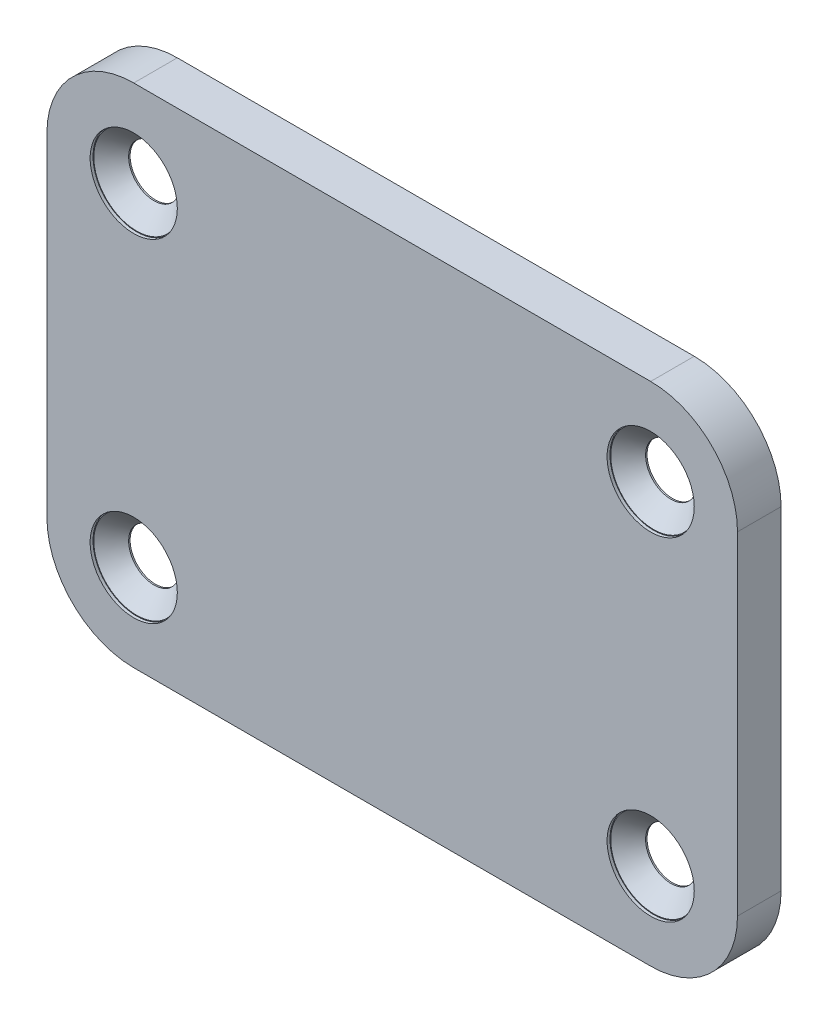
from build123d import *

# Parameters (mm, degrees)
SKETCH1_R           = 1.75
BOSS_EXTRUDE1_DEPTH = 1.5
BOSS_EXTRUDE2_START = 1.5
BOSS_EXTRUDE2_DEPTH = 1.5
CUT_EXTRUDE1_DEPTH  = 0.5
SKETCH4_R           = 3
CUT_EXTRUDE2_DEPTH  = 0.2
CHAMFER1_SIZE       = 1.2


with BuildPart() as part:
    # Sketch1 → Boss-Extrude1 (new body)
    with BuildSketch(Plane.XY):
        with BuildLine():
            Line((-17.7875, -17.425), (17.7875, -17.425))
            ThreePointArc((17.7875, -17.425), (22.012463018, -15.674963018), (23.7625, -11.45))
            Line((23.7625, -11.45), (23.7625, 11.45))
            ThreePointArc((23.7625, 11.45), (22.012463018, 15.674963018), (17.7875, 17.425))
            Line((17.7875, 17.425), (-17.7875, 17.425))
            ThreePointArc((-17.7875, 17.425), (-22.012463018, 15.674963018), (-23.7625, 11.45))
            Line((-23.7625, 11.45), (-23.7625, -11.45))
            ThreePointArc((-23.7625, -11.45), (-22.012463018, -15.674963018), (-17.7875, -17.425))
        make_face()
        with Locations((-17.7875, -11.45)):
            Circle(SKETCH1_R, mode=Mode.SUBTRACT)
        with Locations((17.7875, -11.45)):
            Circle(SKETCH1_R, mode=Mode.SUBTRACT)
        with Locations((-17.7875, 11.45)):
            Circle(SKETCH1_R, mode=Mode.SUBTRACT)
        with Locations((17.7875, 11.45)):
            Circle(SKETCH1_R, mode=Mode.SUBTRACT)
    extrude(amount=BOSS_EXTRUDE1_DEPTH)

    # Sketch2 → Boss-Extrude2 (add)
    with BuildSketch(Plane(origin=(0, 0, 0), x_dir=(-1, 0, 0), z_dir=(0, 0, -1)).offset(BOSS_EXTRUDE2_START)):
        with BuildLine():
            Line((-17.7875, -17.425), (17.7875, -17.425))
            ThreePointArc((17.7875, -17.425), (22.012463018, -15.674963018), (23.7625, -11.45))
            Line((23.7625, -11.45), (23.7625, 11.45))
            ThreePointArc((23.7625, 11.45), (22.012463018, 15.674963018), (17.7875, 17.425))
            Line((17.7875, 17.425), (-17.7875, 17.425))
            ThreePointArc((-17.7875, 17.425), (-22.012463018, 15.674963018), (-23.7625, 11.45))
            Line((-23.7625, 11.45), (-23.7625, -11.45))
            ThreePointArc((-23.7625, -11.45), (-22.012463018, -15.674963018), (-17.7875, -17.425))
        make_face()
        with BuildLine():
            Line((17.7875, 15.925), (-17.7875, 15.925))
            ThreePointArc((-17.7875, 15.925), (-20.951802846, 14.614302846), (-22.2625, 11.45))
            Line((-22.2625, 11.45), (-22.2625, -11.45))
            ThreePointArc((-22.2625, -11.45), (-20.951802846, -14.614302846), (-17.7875, -15.925))
            Line((-17.7875, -15.925), (17.7875, -15.925))
            ThreePointArc((17.7875, -15.925), (20.951802846, -14.614302846), (22.2625, -11.45))
            Line((22.2625, -11.45), (22.2625, 11.45))
            ThreePointArc((22.2625, 11.45), (20.951802846, 14.614302846), (17.7875, 15.925))
        make_face(mode=Mode.SUBTRACT)
    extrude(amount=-BOSS_EXTRUDE2_DEPTH)

    # Sketch3 → Cut-Extrude1 (cut)
    with BuildSketch(Plane(origin=(0, 0, 0), x_dir=(-1, 0, 0), z_dir=(0, 0, -1))):
        with BuildLine():
            Line((17.7875, -6.975), (22.2625, -6.975))
            Line((22.2625, -6.975), (22.2625, 6.975))
            Line((22.2625, 6.975), (17.7875, 6.975))
            ThreePointArc((17.7875, 6.975), (14.623197154, 8.285697154), (13.3125, 11.45))
            Line((13.3125, 11.45), (13.3125, 15.925))
            Line((13.3125, 15.925), (-13.3125, 15.925))
            Line((-13.3125, 15.925), (-13.3125, 11.45))
            ThreePointArc((-13.3125, 11.45), (-14.623197154, 8.285697154), (-17.7875, 6.975))
            Line((-17.7875, 6.975), (-22.2625, 6.975))
            Line((-22.2625, 6.975), (-22.2625, -6.975))
            Line((-22.2625, -6.975), (-13.3125, -6.975))
            Line((-13.3125, -6.975), (-13.3125, -15.925))
            Line((-13.3125, -15.925), (13.3125, -15.925))
            Line((13.3125, -15.925), (13.3125, -11.45))
            ThreePointArc((13.3125, -11.45), (14.623197154, -8.285697154), (17.7875, -6.975))
        make_face()
    extrude(amount=-CUT_EXTRUDE1_DEPTH, mode=Mode.SUBTRACT)

    # Sketch4 → Cut-Extrude2 (cut)
    with BuildSketch(Plane.XY.offset(1.5)):
        with Locations((-17.7875, 11.45)):
            Circle(SKETCH4_R)
        with Locations((17.7875, 11.45)):
            Circle(SKETCH4_R)
        with Locations((17.7875, -11.45)):
            Circle(SKETCH4_R)
        with Locations((-17.7875, -11.45)):
            Circle(SKETCH4_R)
    extrude(amount=-CUT_EXTRUDE2_DEPTH, mode=Mode.SUBTRACT)

    # Chamfer1
    chamfer1_edges = [part.edges().sort_by_distance(p)[0] for p in [
        (-19.5375, -11.45, 1.3),
        (16.0375, -11.45, 1.3),
        (16.0375, 11.45, 1.3),
        (-19.5375, 11.45, 1.3),
    ]]
    chamfer(chamfer1_edges, length=CHAMFER1_SIZE)


solid = part.part
